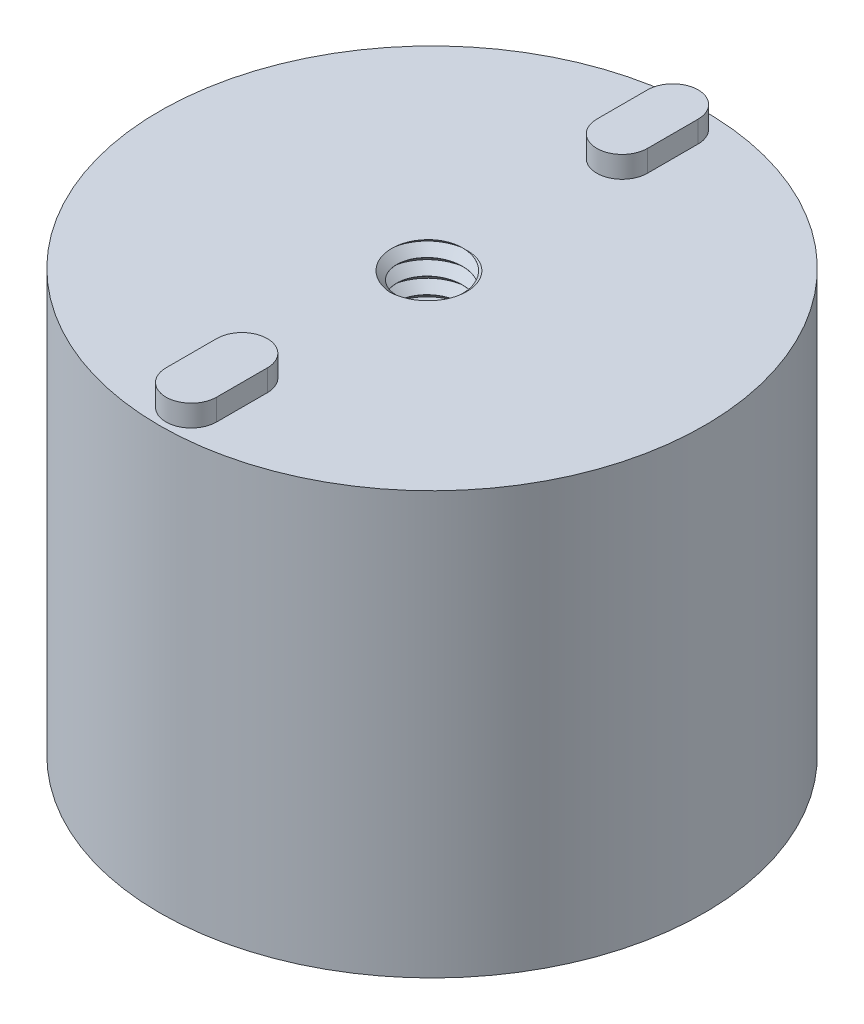
from build123d import *

# Parameters (mm, degrees)
SKETCH_1_R               = 21.5
SKETCH_1_R_2             = 1.7
EXTRUDE_1_DEPTH          = 25
EXTRUDE_START            = 10
SKETCH_1_2_R             = 21.5
EXTRUDE_2_DEPTH          = 10
SKETCH_2_R               = 21.5
CUT_EXTRUDE_1_DEPTH      = 1.7
SKETCH_3_2_R             = 2.6
CUT_EXTRUDE_2_DEPTH      = 15
SWEEP_1_PITCH            = 1.27
SWEEP_2_PITCH            = 0.7
PATTERN_CIRCULAR_2_COUNT = 2
SKETCH_8_R               = 5.1
CUT_EXTRUDE_3_DEPTH      = 10
FILLET_1_R               = 5


with BuildPart() as part:
    # 草图1 → 凸台-拉伸1 (new body)
    with BuildSketch(Plane(origin=(0, 0, 0), x_dir=(1, 0, 0), z_dir=(0, 1, 0))):
        with Locations(Location((0, 0, 0), (0, 0, 270))):
            Circle(SKETCH_1_R)
        with Locations(Location((0, 16, 0), (0, 0, 270))):
            Circle(SKETCH_1_R_2, mode=Mode.SUBTRACT)
        with Locations(Location((0, -16, 0), (0, 0, 270))):
            Circle(SKETCH_1_R_2, mode=Mode.SUBTRACT)
    extrude(amount=-EXTRUDE_1_DEPTH)

    # 草图1<2> → 凸台-拉伸2 (add)
    with BuildSketch(Plane(origin=(0, 0, 0), x_dir=(1, 0, 0), z_dir=(0, 1, 0)).offset(EXTRUDE_START)):
        with Locations(Location((0, 0, 0), (0, 0, 270))):
            Circle(SKETCH_1_2_R)
    extrude(amount=-EXTRUDE_2_DEPTH)

    # 草图2 → 切除-拉伸1 (cut)
    with BuildSketch(Plane(origin=(0, 10, 0), x_dir=(1, 0, 0), z_dir=(0, 1, 0))):
        with Locations(Location((0, 0, 0), (0, 0, 270))):
            Circle(SKETCH_2_R)
        with BuildLine():
            Line((-2, 15), (-2, 19))
            ThreePointArc((-2, 19), (0, 21), (2, 19))
            Line((2, 19), (2, 15))
            ThreePointArc((2, 15), (0, 13), (-2, 15))
        make_face(mode=Mode.SUBTRACT)
        with BuildLine():
            Line((-2, -19), (-2, -15))
            ThreePointArc((-2, -15), (0, -13), (2, -15))
            Line((2, -15), (2, -19))
            ThreePointArc((2, -19), (0, -21), (-2, -19))
        make_face(mode=Mode.SUBTRACT)
    extrude(amount=-CUT_EXTRUDE_1_DEPTH, mode=Mode.SUBTRACT)

    # 草图3<2> → 切除-拉伸2 (cut)
    with BuildSketch(Plane(origin=(0, 8.3, 0), x_dir=(1, 0, 0), z_dir=(0, 1, 0))):
        with Locations(Location((0, 0, 0), (0, 0, 270))):
            Circle(SKETCH_3_2_R)
    extrude(amount=-CUT_EXTRUDE_2_DEPTH, mode=Mode.SUBTRACT)

    # 切除-扫描1: arcs per turn and ends read off the stored shape
    # 切除-扫描1: the profile of 草图4 screwed along a right-hand helix through 13 turns, 8 arcs to a turn; built about Z, then put on its axis
    sweep_1_z = Axis((0, 0, 0), (0, 0, 1))
    sweep_1_corners = [(2.6, 0, -1.27), (2.6, 0, -0.64), (3.3, 0, -1.27), (2.6, 0, -1.9)]
    with BuildLine(mode=Mode.PRIVATE) as sweep_1_profile:
        Line(sweep_1_corners[0], sweep_1_corners[1])
        Line(sweep_1_corners[1], sweep_1_corners[2])
        Line(sweep_1_corners[2], sweep_1_corners[3])
        Line(sweep_1_corners[3], sweep_1_corners[0])
    sweep_1_cap = Face(sweep_1_profile.wire())
    sweep_1_turn_angles = [0, 22.5, 45, 67.5, 90, 112.5, 135, 157.5, 180, 202.5, 225, 247.5, 270, 292.5, 315, 337.5, 360]
    sweep_1_turn_weights = [1, 0.9238795325112867, 1, 0.9238795325112867, 1, 0.9238795325112867, 1, 0.9238795325112867, 1, 0.9238795325112867, 1, 0.9238795325112867, 1, 0.9238795325112867, 1, 0.9238795325112867, 1]
    sweep_1_turn_rails = [Edge.make_bspline([Vector(p[0], p[1], 0).rotate(sweep_1_z, sweep_1_turn_angles[k]) / sweep_1_turn_weights[k] + Vector(0, 0, p[2] + SWEEP_1_PITCH * sweep_1_turn_angles[k] / 360) for k in range(17)], [0, 0, 0, 1, 1, 2, 2, 3, 3, 4, 4, 5, 5, 6, 6, 7, 7, 8, 8, 8], 2, sweep_1_turn_weights) for p in sweep_1_corners]
    sweep_1_turn_sides = [Face.make_surface_from_curves(sweep_1_turn_rails[p[0]], sweep_1_turn_rails[p[1]]) for p in [(0, 1), (1, 2), (2, 3), (3, 0)]]
    sweep_1 = Plane(origin=(0, 8.3, 0), x_dir=(0, 0, 1), z_dir=(0, -1, 0)) * Solid(Shell([*[p.moved(Location((0, 0, SWEEP_1_PITCH * i))) for i in range(13) for p in sweep_1_turn_sides], sweep_1_cap, sweep_1_cap.rotate(sweep_1_z, 4680).moved(Location((0, 0, SWEEP_1_PITCH * 4680 / 360)))]))
    add(sweep_1, mode=Mode.SUBTRACT)

    # 切除-扫描2: arcs per turn and ends read off the stored shape
    # 切除-扫描2: the profile of 草图7 screwed along a right-hand helix through 36.75 turns, 6 arcs to a turn; built about Z, then put on its axis
    sweep_2_z = Axis((0, 0, 0), (0, 0, 1))
    sweep_2_corners = [(1.7, 0, -0.7), (1.7, 0, -0.351), (2, 0, -0.7), (1.7, 0, -1.049)]
    with BuildLine(mode=Mode.PRIVATE) as sweep_2_profile:
        Line(sweep_2_corners[0], sweep_2_corners[1])
        Line(sweep_2_corners[1], sweep_2_corners[2])
        Line(sweep_2_corners[2], sweep_2_corners[3])
        Line(sweep_2_corners[3], sweep_2_corners[0])
    sweep_2_cap = Face(sweep_2_profile.wire())
    sweep_2_turn_angles = [0, 30, 60, 90, 120, 150, 180, 210, 240, 270, 300, 330, 360]
    sweep_2_turn_weights = [1, 0.8660254037844387, 1, 0.8660254037844387, 1, 0.8660254037844387, 1, 0.8660254037844387, 1, 0.8660254037844387, 1, 0.8660254037844387, 1]
    sweep_2_turn_rails = [Edge.make_bspline([Vector(p[0], p[1], 0).rotate(sweep_2_z, sweep_2_turn_angles[k]) / sweep_2_turn_weights[k] + Vector(0, 0, p[2] + SWEEP_2_PITCH * sweep_2_turn_angles[k] / 360) for k in range(13)], [0, 0, 0, 1, 1, 2, 2, 3, 3, 4, 4, 5, 5, 6, 6, 6], 2, sweep_2_turn_weights) for p in sweep_2_corners]
    sweep_2_turn_sides = [Face.make_surface_from_curves(sweep_2_turn_rails[p[0]], sweep_2_turn_rails[p[1]]) for p in [(0, 1), (1, 2), (2, 3), (3, 0)]]
    sweep_2_last_angles = [12960, 12990, 13020, 13050, 13080, 13110, 13140, 13170, 13200, 13215, 13230]
    sweep_2_last_weights = [1, 0.8660254037844387, 1, 0.8660254037844387, 1, 0.8660254037844387, 1, 0.8660254037844387, 1, 0.9659258262890683, 1]
    sweep_2_last_rails = [Edge.make_bspline([Vector(p[0], p[1], 0).rotate(sweep_2_z, sweep_2_last_angles[k]) / sweep_2_last_weights[k] + Vector(0, 0, p[2] + SWEEP_2_PITCH * sweep_2_last_angles[k] / 360) for k in range(11)], [0, 0, 0, 1, 1, 2, 2, 3, 3, 4, 4, 5, 5, 5], 2, sweep_2_last_weights) for p in sweep_2_corners]
    sweep_2_last_sides = [Face.make_surface_from_curves(sweep_2_last_rails[p[0]], sweep_2_last_rails[p[1]]) for p in [(0, 1), (1, 2), (2, 3), (3, 0)]]
    sweep_2 = Plane(origin=(0, -25, 16), x_dir=(0, 0, -1), z_dir=(0, 1, 0)) * Solid(Shell([*[p.moved(Location((0, 0, SWEEP_2_PITCH * i))) for i in range(36) for p in sweep_2_turn_sides], *sweep_2_last_sides, sweep_2_cap, sweep_2_cap.rotate(sweep_2_z, 13230).moved(Location((0, 0, SWEEP_2_PITCH * 13230 / 360)))]))
    add(sweep_2, mode=Mode.SUBTRACT)

    # 阵列(圆周)2: 切除-扫描2 ×2 about axis
    pattern_circular_2_axis = Axis((0, -25, 0), (0, 1, 0))
    for i in range(1, PATTERN_CIRCULAR_2_COUNT):
        add(sweep_2.rotate(pattern_circular_2_axis, i * 360 / PATTERN_CIRCULAR_2_COUNT), mode=Mode.SUBTRACT)

    # 草图8 → 切除-拉伸3 (cut)
    with BuildSketch(Plane.XZ.offset(25)):
        with Locations(Location((0, 0, 0), (0, 0, 270))):
            Circle(SKETCH_8_R)
    extrude(amount=-CUT_EXTRUDE_3_DEPTH, mode=Mode.SUBTRACT)

    # 圆角1
    fillet_1_edges = [part.edges().sort_by_distance(p)[0] for p in [
        (0, -15, 5.1),
    ]]
    fillet(fillet_1_edges, radius=FILLET_1_R)


solid = part.part
